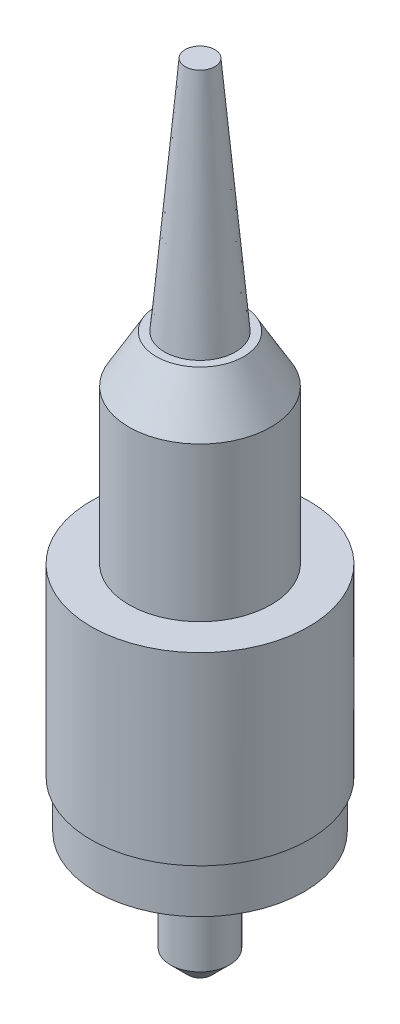
from build123d import *

# Parameters (mm, degrees)
SKETCH_1_R          = 4.6
EXTRUDE_1_DEPTH     = 9.8
SKETCH_2_R          = 4.6
SKETCH_2_R_2        = 4.4
CUT_EXTRUDE_1_DEPTH = 2
SKETCH_3_R          = 3.9
SKETCH_3_R_2        = 2.9
CUT_EXTRUDE_2_DEPTH = 4
SKETCH_4_R          = 2.4
CUT_EXTRUDE_3_DEPTH = 5
SKETCH_5_R          = 1.25
EXTRUDE_4_DEPTH     = 10
CHAMFER_1_SIZE      = 0.75
EXTRUDE_START       = 1
SKETCH_6_R          = 2.9
SKETCH_6_R_2        = 2.4
EXTRUDE_5_DEPTH     = 1
SKETCH_7_R          = 3
EXTRUDE_6_DEPTH     = 8.5
CHAMFER_2_SIZE      = 2
CHAMFER_2_SIZE2     = 1.154700538
SKETCH_8_R          = 1.5
EXTRUDE_7_DEPTH     = 10
CHAMFER_3_SIZE      = 10
CHAMFER_3_SIZE_2    = 0.874886635


with BuildPart() as part:
    # 草图1 → 拉伸1 (new body)
    with BuildSketch(Plane(origin=(0, 0, 0), x_dir=(1, 0, 0), z_dir=(0, 1, 0))):
        with Locations(Location((0, 0, 0), (0, 0, 270))):
            Circle(SKETCH_1_R)
    extrude(amount=EXTRUDE_1_DEPTH)

    # 草图2 → 切除-拉伸1 (cut)
    with BuildSketch(Plane.XZ):
        with Locations(Location((0, 0, 0), (0, 0, 270))):
            Circle(SKETCH_2_R)
        with Locations(Location((0, 0, 0), (0, 0, 270))):
            Circle(SKETCH_2_R_2, mode=Mode.SUBTRACT)
    extrude(amount=-CUT_EXTRUDE_1_DEPTH, mode=Mode.SUBTRACT)

    # 草图3 → 切除-拉伸2 (cut)
    with BuildSketch(Plane.XZ):
        with Locations(Location((0, 0, 0), (0, 0, 270))):
            Circle(SKETCH_3_R)
        with Locations(Location((0, 0, 0), (0, 0, 270))):
            Circle(SKETCH_3_R_2, mode=Mode.SUBTRACT)
    extrude(amount=-CUT_EXTRUDE_2_DEPTH, mode=Mode.SUBTRACT)

    # 草图4 → 切除-拉伸3 (cut)
    with BuildSketch(Plane.XZ):
        with Locations(Location((0, 0, 0), (0, 0, 270))):
            Circle(SKETCH_4_R)
    extrude(amount=-CUT_EXTRUDE_3_DEPTH, mode=Mode.SUBTRACT)

    # 草图5 → 拉伸4 (add)
    with BuildSketch(Plane.XZ.offset(-5)):
        with Locations(Location((0, 0, 0), (0, 0, 270))):
            Circle(SKETCH_5_R)
    extrude(amount=EXTRUDE_4_DEPTH)

    # 倒角1
    chamfer_1_edges = [part.edges().sort_by_distance(p)[0] for p in [
        (0, -5, 1.25),
    ]]
    chamfer(chamfer_1_edges, length=CHAMFER_1_SIZE)

    # 草图6 → 拉伸5 (add)
    with BuildSketch(Plane.XZ.offset(EXTRUDE_START)):
        with Locations(Location((0, 0, 0), (0, 0, 270))):
            Circle(SKETCH_6_R)
        with Locations(Location((0, 0, 0), (0, 0, 270))):
            Circle(SKETCH_6_R_2, mode=Mode.SUBTRACT)
    extrude(amount=-EXTRUDE_5_DEPTH)

    # 草图7 → 拉伸6 (add)
    with BuildSketch(Plane(origin=(0, 9.8, 0), x_dir=(-1, 0, 0), z_dir=(0, 1, 0))):
        with Locations(Location((0, 0, 0), (0, 0, 90))):
            Circle(SKETCH_7_R)
    extrude(amount=EXTRUDE_6_DEPTH)

    # 倒角2
    chamfer_2_edges = [part.edges().sort_by_distance(p)[0] for p in [
        (0, 18.3, -3),
    ]]
    chamfer_2_side = [part.faces().sort_by_distance(p)[0] for p in [
        (0, 14.05, -3),
    ]]
    chamfer(chamfer_2_edges, length=CHAMFER_2_SIZE, length2=CHAMFER_2_SIZE2, reference=chamfer_2_side[0])

    # 草图8 → 拉伸7 (add)
    with BuildSketch(Plane(origin=(0, 18.3, 0), x_dir=(-1, 0, 0), z_dir=(0, 1, 0))):
        with Locations(Location((0, 0, 0), (0, 0, 90))):
            Circle(SKETCH_8_R)
    extrude(amount=EXTRUDE_7_DEPTH)

    # 倒角3
    # the kernel refuses this chamfer: 10, 0.874886635 mm, written as the material it takes off along each edge
    with BuildSketch(Plane(origin=(0, 28.3, 0), x_dir=(0, 0, 1), z_dir=(-1, 0, 0))) as chamfer_3_piece_1_section:
        Polygon((1.5, -CHAMFER_3_SIZE), (1.5 - CHAMFER_3_SIZE_2, 0), (1.5, 0), align=None)
    chamfer_3_piece_1 = revolve(axis=Axis((0, 28.3, 0), (0, 1, 0)), mode=Mode.PRIVATE)
    chamfer_3_piece_1 = split(chamfer_3_piece_1, bisect_by=Plane(origin=(0, 18.3, -1.083102127), z_dir=(0, 1, 0)), keep=Keep.TOP, mode=Mode.PRIVATE)
    add(chamfer_3_piece_1, mode=Mode.SUBTRACT)


solid = part.part
